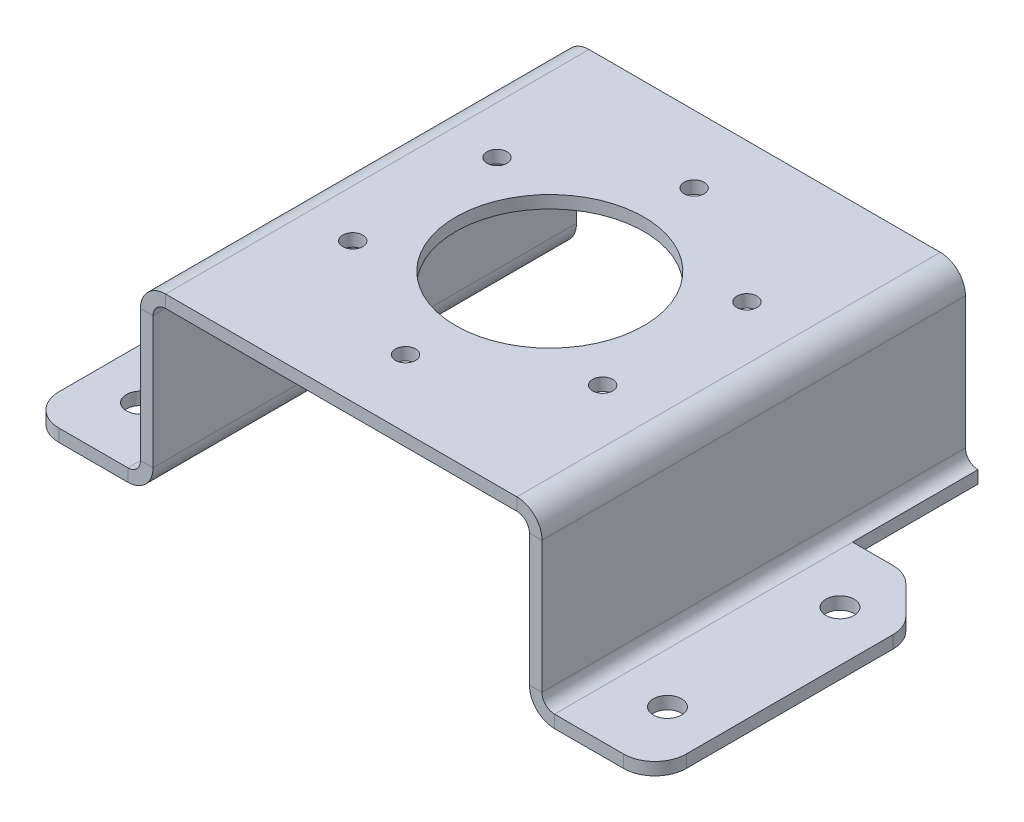
from build123d import *

# Parameters (mm, degrees)
TABAN_FLAN_1_DEPTH      = 135
IZIM2_R                 = 3.2
IZIM2_R_2               = 30
KES_EKSTR_ZYON1_DEPTH   = 10
KENAR_FLAN_1_DEPTH      = 135
KENAR_FLAN_1_BEND_DEPTH = 135
IZIM6_W                 = 32
IZIM6_H                 = 40
KES_EKSTR_ZYON2_DEPTH   = 10
RADYUS2_R               = 10
IZIM10_R                = 4.5
KES_EKSTR_ZYON3_DEPTH   = 10
PAH1_SIZE               = 15
RADYUS3_R               = 10


# Sheet-metal steps are written as plain solids
with BuildPart() as part:
    # Çizim1 → Taban-Flanş1 (new body)
    with BuildSketch(Plane.XY):
        with BuildLine():
            Line((0, 0), (0, 42))
            ThreePointArc((0, 42), (2.343145751, 47.656854249), (8, 50))
            Line((8, 50), (120, 50))
            ThreePointArc((120, 50), (125.656854249, 47.656854249), (128, 42))
            Line((128, 42), (128, 0))
            Line((128, 0), (124, 0))
            Line((124, 0), (124, 42))
            ThreePointArc((124, 42), (122.828427125, 44.828427125), (120, 46))
            Line((120, 46), (8, 46))
            ThreePointArc((8, 46), (5.171572875, 44.828427125), (4, 42))
            Line((4, 42), (4, 0))
            Line((4, 0), (0, 0))
        make_face()
    extrude(amount=TABAN_FLAN_1_DEPTH)

    # Çizim2 → Kes-Ekstrüzyon1 (cut)
    with BuildSketch(Plane(origin=(0, 50, 0), x_dir=(1, 0, 0), z_dir=(0, 1, 0))):
        with Locations(Location((63, -21.5, 0), (0, 0, 270))):
            Circle(IZIM2_R)
        with Locations(Location((102.837168574, -44.5, 0), (0, 0, 270))):
            Circle(IZIM2_R)
        with Locations(Location((102.837168574, -90.5, 0), (0, 0, 270))):
            Circle(IZIM2_R)
        with Locations(Location((63, -113.5, 0), (0, 0, 270))):
            Circle(IZIM2_R)
        with Locations(Location((23.162831426, -90.5, 0), (0, 0, 270))):
            Circle(IZIM2_R)
        with Locations(Location((23.162831426, -44.5, 0), (0, 0, 270))):
            Circle(IZIM2_R)
        with Locations(Location((63, -67.5, 0), (0, 0, 270))):
            Circle(IZIM2_R_2)
    extrude(amount=-KES_EKSTR_ZYON1_DEPTH, mode=Mode.SUBTRACT)

    # Kenar-Flanş1 section (across the edge) → Kenar-Flanş1 (add)
    with BuildSketch(Plane(origin=(128, -4, 135), x_dir=(0, 1, 0), z_dir=(0, 0, -1))):
        with BuildLine():
            Line((-4, 4), (-4, 36))
            Line((-4, 36), (0, 36))
            Line((0, 36), (0, 4))
            ThreePointArc((0, 4), (1.171572875, 1.171572875), (4, 0))
            Line((4, 0), (4, -4))
            ThreePointArc((4, -4), (-1.656854249, -1.656854249), (-4, 4))
        make_face()
    extrude(amount=KENAR_FLAN_1_DEPTH)

    # Kenar-Flanş1 section 2 (across the edge) → Kenar-Flanş1 bend (add)
    with BuildSketch(Plane(origin=(0, -4, 0), x_dir=(0, 1, 0), z_dir=(0, 0, 1))):
        with BuildLine():
            Line((-4, 4), (-4, 36))
            Line((-4, 36), (0, 36))
            Line((0, 36), (0, 4))
            ThreePointArc((0, 4), (1.171572875, 1.171572875), (4, 0))
            Line((4, 0), (4, -4))
            ThreePointArc((4, -4), (-1.656854249, -1.656854249), (-4, 4))
        make_face()
    extrude(amount=KENAR_FLAN_1_BEND_DEPTH)

    # Çizim6 → Kes-Ekstrüzyon2 (cut)
    with BuildSketch(Plane(origin=(0, -4, 0), x_dir=(1, 0, 0), z_dir=(0, 1, 0))):
        with Locations((148, -20)):
            Rectangle(IZIM6_W, IZIM6_H)
    extrude(amount=-KES_EKSTR_ZYON2_DEPTH, mode=Mode.SUBTRACT)

    # Radyus2
    radyus2_edges = [part.edges().sort_by_distance(p)[0] for p in [
        (-36, -6, 0),
        (-36, -6, 135),
        (164, -6, 135),
    ]]
    fillet(radyus2_edges, radius=RADYUS2_R)

    # Çizim10 → Kes-Ekstrüzyon3 (cut)
    with BuildSketch(Plane(origin=(0, -4, 0), x_dir=(1, 0, 0), z_dir=(0, 1, 0))):
        with Locations(Location((148, -115, 0), (0, 0, 180))):
            Circle(IZIM10_R)
        with Locations(Location((148, -60, 0), (0, 0, 180))):
            Circle(IZIM10_R)
        with Locations(Location((-20, -115, 0), (0, 0, 180))):
            Circle(IZIM10_R)
        with Locations(Location((-20, -35, 0), (0, 0, 180))):
            Circle(IZIM10_R)
    extrude(amount=-KES_EKSTR_ZYON3_DEPTH, mode=Mode.SUBTRACT)

    # Pah1
    pah1_edges = [part.edges().sort_by_distance(p)[0] for p in [
        (164, -6, 40),
    ]]
    chamfer(pah1_edges, length=PAH1_SIZE)

    # Radyus3
    radyus3_edges = [part.edges().sort_by_distance(p)[0] for p in [
        (164, -6, 55),
        (149, -6, 40),
    ]]
    fillet(radyus3_edges, radius=RADYUS3_R)


solid = part.part
